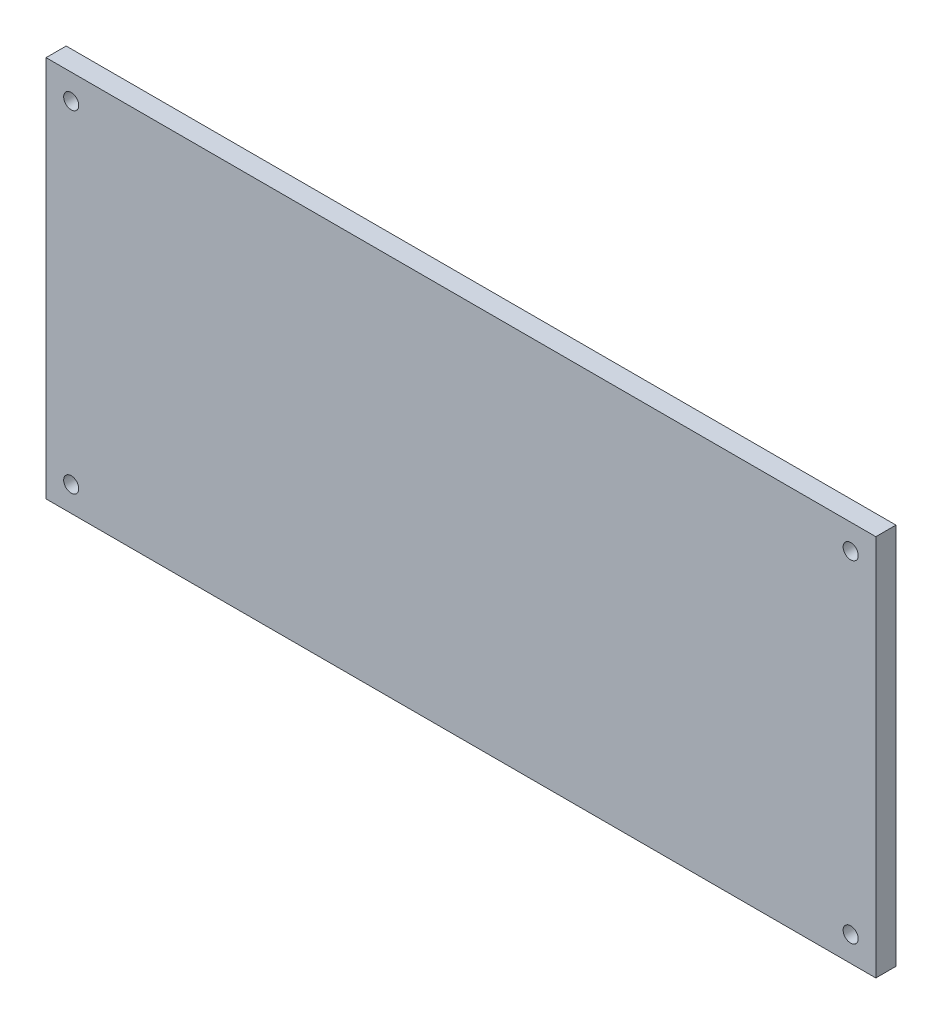
from build123d import *

# Parameters (mm, degrees)
SKETCH1_W           = 165
SKETCH1_H           = 76
SKETCH1_R           = 1.5
BOSS_EXTRUDE1_DEPTH = 4


with BuildPart() as part:
    # Sketch1 → Boss-Extrude1 (new body)
    with BuildSketch(Plane.XY):
        with Locations((73.551190283, 33.33623097)):
            Rectangle(SKETCH1_W, SKETCH1_H)
        with Locations((-3.948809717, 0.33623097)):
            Circle(SKETCH1_R, mode=Mode.SUBTRACT)
        with Locations((151.051190283, 0.33623097)):
            Circle(SKETCH1_R, mode=Mode.SUBTRACT)
        with Locations((151.051190283, 66.33623097)):
            Circle(SKETCH1_R, mode=Mode.SUBTRACT)
        with Locations((-3.948809717, 66.33623097)):
            Circle(SKETCH1_R, mode=Mode.SUBTRACT)
    extrude(amount=BOSS_EXTRUDE1_DEPTH)


solid = part.part
